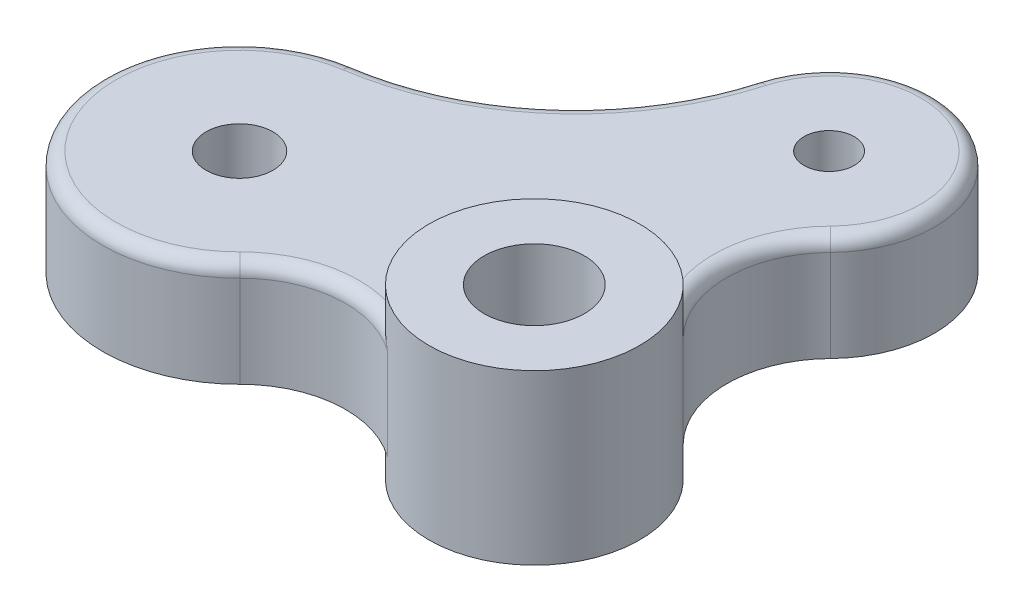
from build123d import *

# Parameters (mm, degrees)
SKETCH2_R           = 25.0063
SKETCH2_R_2         = 11.9126
BOSS_EXTRUDE2_DEPTH = 20.0025
SKETCH2_3_R         = 7.9375
SKETCH2_3_R_2       = 5.9563
BOSS_EXTRUDE3_DEPTH = 12.4968
FILLET1_R           = 3.175


with BuildPart() as part:
    # Sketch2 → Boss-Extrude2 (new, symmetric)
    with BuildSketch(Plane(origin=(0, 0, 0), x_dir=(1, 0, 0), z_dir=(0, 1, 0))):
        with Locations(Location((0, 0, 0), (0, 0, 270))):
            Circle(SKETCH2_R)
        with Locations(Location((0, 0, 0), (0, 0, 270))):
            Circle(SKETCH2_R_2, mode=Mode.SUBTRACT)
    extrude(amount=BOSS_EXTRUDE2_DEPTH, both=True)

    # Sketch2<3> → Boss-Extrude3 (add, symmetric)
    with BuildSketch(Plane(origin=(0, 0, 0), x_dir=(1, 0, 0), z_dir=(0, 1, 0))):
        with BuildLine():
            ThreePointArc((-14.627829046, -20.281559533), (-18.962185595, 16.301857476), (17.857447567, 17.505045161))
            ThreePointArc((17.857447567, 17.505045161), (10.712225835, 35.0012), (17.857447567, 52.497354839))
            ThreePointArc((17.857447567, 52.497354839), (12.561079617, 91.624941907), (-24.05225317, 76.843756383))
            ThreePointArc((-24.05225317, 76.843756383), (-42.87857023, 47.021182923), (-74.850980968, 32.135584063))
            ThreePointArc((-74.850980968, 32.135584063), (-98.995210512, -14.684053906), (-46.965085328, -22.923495222))
            ThreePointArc((-46.965085328, -22.923495222), (-31.283411202, -15.642216981), (-14.627829046, -20.281559533))
        make_face()
        with Locations(Location((-70.0024, 0, 0), (0, 0, 270))):
            Circle(SKETCH2_3_R, mode=Mode.SUBTRACT)
        with Locations(Location((0, 70.0024, 0), (0, 0, 270))):
            Circle(SKETCH2_3_R_2, mode=Mode.SUBTRACT)
    extrude(amount=BOSS_EXTRUDE3_DEPTH, both=True)

    # Fillet1
    # the kernel refuses this fillet: 3.175 mm, written as the material it takes off along each edge
    with BuildSketch(Plane(origin=(-84.17677836, 12.4968, -93.945410073), x_dir=(0.9618477411525731, 0, 0.2735853118127743), z_dir=(0.2735853118127743, 0, -0.9618477411525731))) as fillet1_piece_1:
        with BuildLine():
            CenterArc((62.5094 + FILLET1_R, FILLET1_R), FILLET1_R, 180, 90)
            Line((62.5094, FILLET1_R), (62.5094, 0))
            Line((62.5094, 0), (62.5094 + FILLET1_R, 0))
        make_face()
    revolve(axis=Axis((-84.17677836, 12.4968, -93.945410073), (0, -1, 0)), revolution_arc=65.542266938, mode=Mode.SUBTRACT)
    with BuildSketch(Plane(origin=(-29.248229028, 12.4968, 40.552818629), x_dir=(-0.7088557190961631, 0, -0.705353506764276), z_dir=(-0.705353506764276, 0, 0.7088557190961631))) as fillet1_piece_2_section:
        with BuildLine():
            CenterArc((24.9936 + FILLET1_R, FILLET1_R), FILLET1_R, 180, 90)
            Line((24.9936 + FILLET1_R, 0), (24.9936, 0))
            Line((24.9936, 0), (24.9936, FILLET1_R))
        make_face()
    fillet1_piece_2 = revolve(axis=Axis((-29.248229028, 12.4968, 40.552818629), (0, -1, 0)), revolution_arc=99.144440238, mode=Mode.PRIVATE)
    fillet1_piece_2 = fillet1_piece_2 - Plane(origin=(0, 11.594758581, 0), x_dir=(0, 0, 1), z_dir=(0, 1, 0)) * Cylinder(25.0063, 113, mode=Mode.PRIVATE)
    add(fillet1_piece_2, mode=Mode.SUBTRACT)
    with BuildSketch(Plane(origin=(35.705825835, 12.4968, -35.0012), x_dir=(-0.45970021745025064, 0, 0.8880741579824245), z_dir=(0.8880741579824245, 0, 0.45970021745025064))) as fillet1_piece_3_section:
        with BuildLine():
            CenterArc((24.9936 + FILLET1_R, FILLET1_R), FILLET1_R, 180, 90)
            Line((24.9936, FILLET1_R), (24.9936, 0))
            Line((24.9936, 0), (24.9936 + FILLET1_R, 0))
        make_face()
    fillet1_piece_3 = revolve(axis=Axis((35.705825835, 12.4968, -35.0012), (0, -1, 0)), revolution_arc=107.06127711, mode=Mode.PRIVATE)
    fillet1_piece_3 = fillet1_piece_3 - Plane(origin=(0, 11.595953035, 0), x_dir=(0, 0, 1), z_dir=(0, 1, 0)) * Cylinder(25.0063, 113, mode=Mode.PRIVATE)
    add(fillet1_piece_3, mode=Mode.SUBTRACT)
    with BuildSketch(Plane(origin=(-70.0024, 12.4968, 0), x_dir=(-0.1491903200484399, 0, -0.9888084993586191), z_dir=(0.9888084993586191, 0, -0.1491903200484399))) as fillet1_piece_4:
        with BuildLine():
            CenterArc((32.4993 - FILLET1_R, -FILLET1_R), FILLET1_R, 0, 90)
            Line((32.4993, -FILLET1_R), (32.4993, 0))
            Line((32.4993, 0), (32.4993 - FILLET1_R, 0))
        make_face()
    revolve(axis=Axis((-70.0024, 12.4968, 0), (0, 1, 0)), revolution_arc=216.561882249, mode=Mode.SUBTRACT)
    with BuildSketch(Plane(origin=(0, 12.4968, -70.0024), x_dir=(0.7141179449388714, 0, 0.7000254000508005), z_dir=(-0.7000254000508005, 0, 0.7141179449388714))) as fillet1_piece_5:
        with BuildLine():
            CenterArc((25.0063 - FILLET1_R, -FILLET1_R), FILLET1_R, 0, 90)
            Line((25.0063, -FILLET1_R), (25.0063, 0))
            Line((25.0063, 0), (25.0063 - FILLET1_R, 0))
        make_face()
    revolve(axis=Axis((0, 12.4968, -70.0024), (0, 1, 0)), revolution_arc=208.551316171, mode=Mode.SUBTRACT)


solid = part.part
